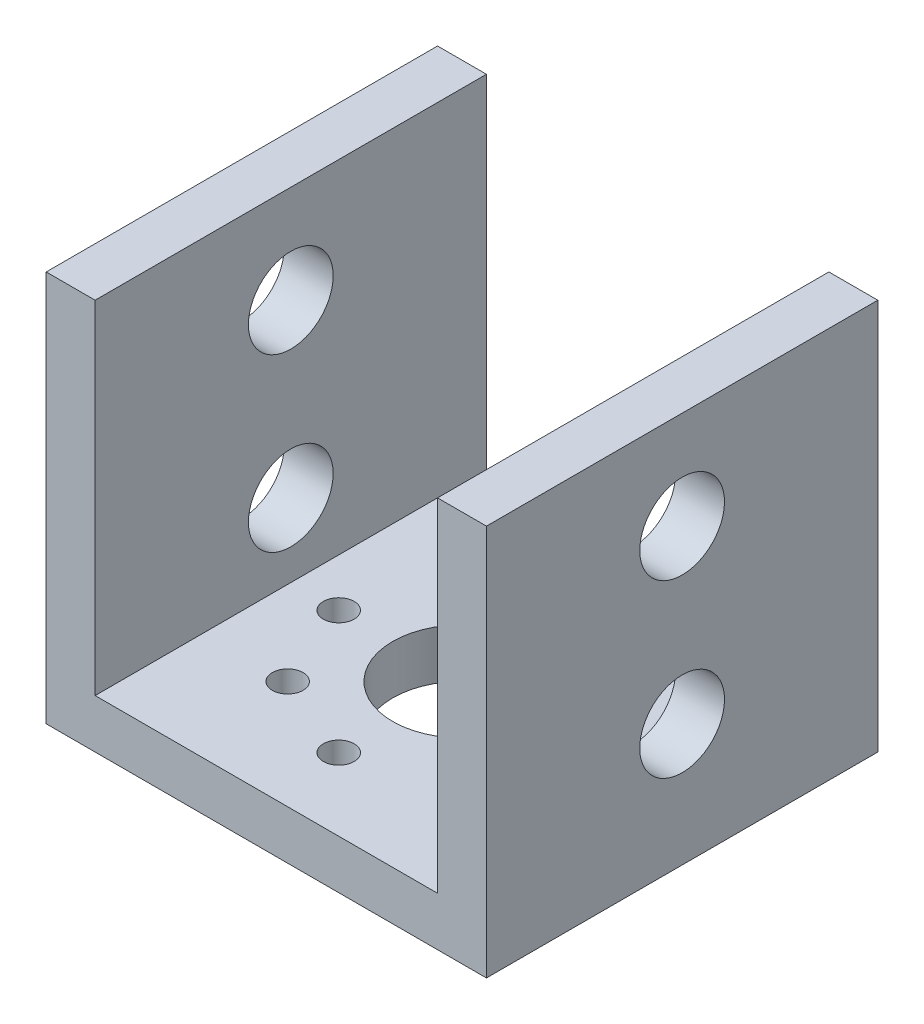
from build123d import *

# Parameters (mm, degrees)
BOSS_EXTRUDE1_DEPTH   = 25.4
SKETCH2_R             = 2.75
CUT_EXTRUDE1_DEPTH    = 45.22263278
SKETCH3_R             = 4.500000017
CUT_EXTRUDE2_DEPTH    = 37.650283508
F_2_0MM_DOWEL_HOLE1_D = 2


with BuildPart() as part:
    # Sketch1 → Boss-Extrude1 (new body)
    with BuildSketch(Plane.XY):
        Polygon((-11.1125, 0), (11.1125, 0), (11.1125, 22.225), (14.2875, 22.225), (14.2875, -3.175), (-14.2875, -3.175), (-14.2875, 22.225), (-11.1125, 22.225), align=None)
    extrude(amount=BOSS_EXTRUDE1_DEPTH)

    # Sketch2 → Cut-Extrude1 (cut, through all)
    with BuildSketch(Plane(origin=(14.2875, 0, 0), x_dir=(0, 0, -1), z_dir=(1, 0, 0))):
        with Locations((-12.7, 15.875)):
            Circle(SKETCH2_R)
        with Locations((-12.7, 4.7625)):
            Circle(SKETCH2_R)
    extrude(amount=-CUT_EXTRUDE1_DEPTH, mode=Mode.SUBTRACT)

    # Sketch3 → Cut-Extrude2 (cut, through all)
    with BuildSketch(Plane(origin=(0, 0, 0), x_dir=(1, 0, 0), z_dir=(0, 1, 0))):
        with Locations((0, -12.7)):
            Circle(SKETCH3_R)
    extrude(amount=-CUT_EXTRUDE2_DEPTH, mode=Mode.SUBTRACT)

    # Ø2.0mm Dowel Hole1 (through all)
    with Locations(Plane(origin=(0, 0, 0), x_dir=(1, 0, 0), z_dir=(0, 1, 0))):
        with Locations((0, -4.699999998), (5.656854251, -7.043145749), (8.000000002, -12.7), (5.656854251, -18.356854251), (0, -20.700000002), (-5.656854251, -18.356854251), (-8.000000002, -12.7), (-5.656854251, -7.043145749)):
            Hole(F_2_0MM_DOWEL_HOLE1_D / 2)


solid = part.part
